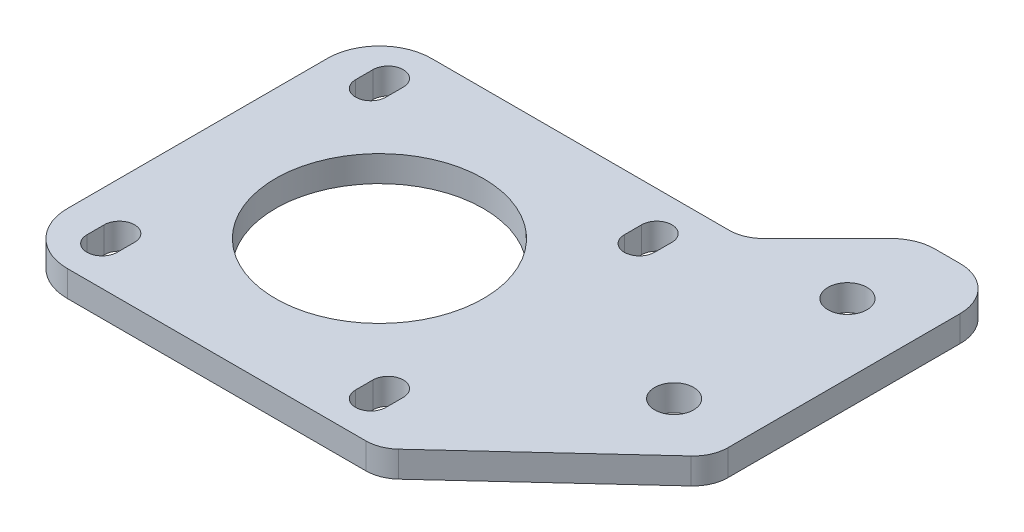
from build123d import *

# Parameters (mm, degrees)
SKETCH2_R           = 12
SKETCH2_R_2         = 2.25
BOSS_EXTRUDE1_DEPTH = 1.5


with BuildPart() as part:
    # Sketch2 → Boss-Extrude1 (new, symmetric)
    with BuildSketch(Plane(origin=(0, 0, 0), x_dir=(1, 0, 0), z_dir=(0, 1, 0))):
        with BuildLine():
            Line((-15, -21), (19.436783066, -21))
            ThreePointArc((19.436783066, -21), (20.892764508, -20.725603044), (22.148987512, -19.94005902))
            Line((22.148987512, -19.94005902), (39.712204446, -3.737991398))
            ThreePointArc((39.712204446, -3.737991398), (40.663933527, -2.402797204), (41, -0.797932378))
            Line((41, -0.797932378), (41, 26))
            ThreePointArc((41, 26), (39.535533906, 29.535533906), (36, 31))
            Line((36, 31), (33.071067812, 31))
            ThreePointArc((33.071067812, 31), (31.15765065, 30.619397663), (29.535533906, 29.535533906))
            Line((29.535533906, 29.535533906), (22.171572875, 22.171572875))
            ThreePointArc((22.171572875, 22.171572875), (20.87387948, 21.30448187), (19.343145751, 21))
            Line((19.343145751, 21), (-15, 21))
            ThreePointArc((-15, 21), (-19.242640687, 19.242640687), (-21, 15))
            Line((-21, 15), (-21, -15))
            ThreePointArc((-21, -15), (-19.242640687, -19.242640687), (-15, -21))
        make_face()
        Circle(SKETCH2_R, mode=Mode.SUBTRACT)
        with Locations((33, 1)):
            Circle(SKETCH2_R_2, mode=Mode.SUBTRACT)
        with Locations((33, 21)):
            Circle(SKETCH2_R_2, mode=Mode.SUBTRACT)
        with BuildLine():
            Line((17.25, -14.5), (17.25, -16.5))
            ThreePointArc((17.25, -16.5), (15.5, -18.25), (13.75, -16.5))
            Line((13.75, -16.5), (13.75, -14.5))
            ThreePointArc((13.75, -14.5), (15.5, -12.75), (17.25, -14.5))
        make_face(mode=Mode.SUBTRACT)
        with BuildLine():
            Line((-13.75, -14.5), (-13.75, -16.5))
            ThreePointArc((-13.75, -16.5), (-15.5, -18.25), (-17.25, -16.5))
            Line((-17.25, -16.5), (-17.25, -14.5))
            ThreePointArc((-17.25, -14.5), (-15.5, -12.75), (-13.75, -14.5))
        make_face(mode=Mode.SUBTRACT)
        with BuildLine():
            Line((13.75, 14.5), (13.75, 16.5))
            ThreePointArc((13.75, 16.5), (15.5, 18.25), (17.25, 16.5))
            Line((17.25, 16.5), (17.25, 14.5))
            ThreePointArc((17.25, 14.5), (15.5, 12.75), (13.75, 14.5))
        make_face(mode=Mode.SUBTRACT)
        with BuildLine():
            Line((-17.25, 14.5), (-17.25, 16.5))
            ThreePointArc((-17.25, 16.5), (-15.5, 18.25), (-13.75, 16.5))
            Line((-13.75, 16.5), (-13.75, 14.5))
            ThreePointArc((-13.75, 14.5), (-15.5, 12.75), (-17.25, 14.5))
        make_face(mode=Mode.SUBTRACT)
    extrude(amount=BOSS_EXTRUDE1_DEPTH, both=True)


solid = part.part
